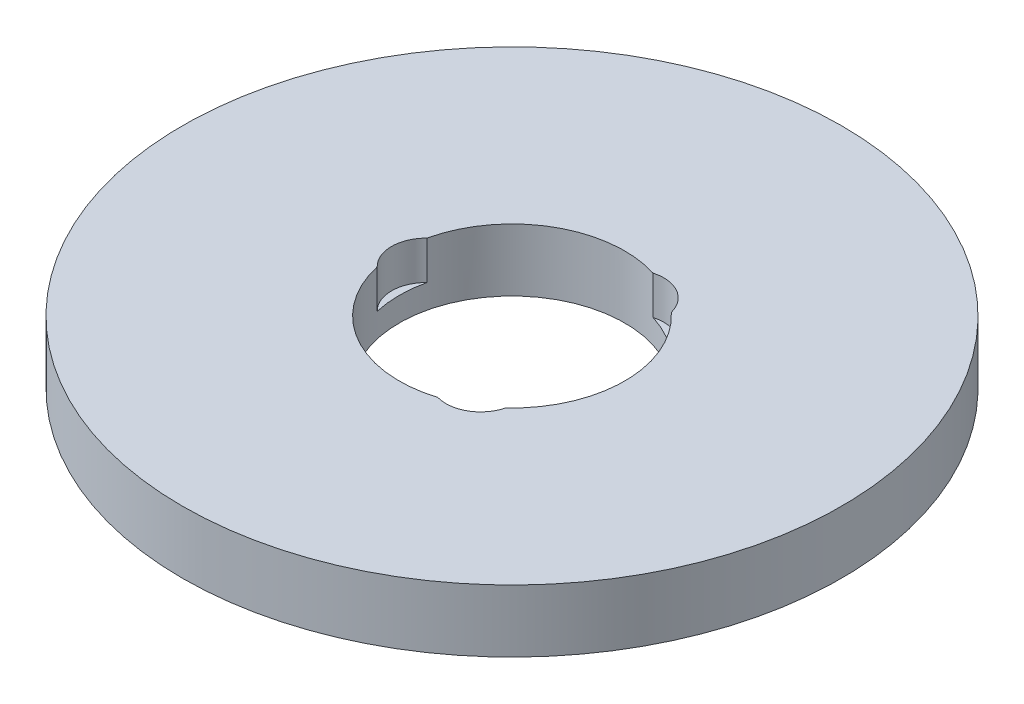
from build123d import *

# Parameters (mm, degrees)
SKETCH1_R           = 95
BOSS_EXTRUDE1_DEPTH = 18
SKETCH2_R           = 32.5
CUT_EXTRUDE1_DEPTH  = 136.550728512
SKETCH3_R           = 10
CUT_EXTRUDE2_DEPTH  = 11.094872479
CIRPATTERN1_COUNT   = 3


with BuildPart() as part:
    # Sketch1 → Boss-Extrude1 (new body)
    with BuildSketch(Plane(origin=(0, 0, 0), x_dir=(1, 0, 0), z_dir=(0, 1, 0))):
        Circle(SKETCH1_R)
    extrude(amount=BOSS_EXTRUDE1_DEPTH)

    # Sketch2 → Cut-Extrude1 (cut, through all)
    with BuildSketch(Plane(origin=(0, 0, 0), x_dir=(1, 0, 0), z_dir=(0, 1, 0))):
        Circle(SKETCH2_R)
    extrude(amount=CUT_EXTRUDE1_DEPTH, mode=Mode.SUBTRACT)

    # Sketch3 → Cut-Extrude2 (cut)
    with BuildSketch(Plane(origin=(0, 18, 0), x_dir=(1, 0, 0), z_dir=(0, 1, 0))):
        with Locations((-24.725930428, 0)):
            Circle(SKETCH3_R)
    cut_extrude2 = extrude(amount=-CUT_EXTRUDE2_DEPTH, mode=Mode.SUBTRACT)

    # CirPattern1: Cut-Extrude2 ×3 about axis
    cirpattern1_axis = Axis((0, 0, 0), (0, 1, 0))
    for i in range(1, CIRPATTERN1_COUNT):
        add(cut_extrude2.rotate(cirpattern1_axis, i * 360 / CIRPATTERN1_COUNT), mode=Mode.SUBTRACT)


solid = part.part
